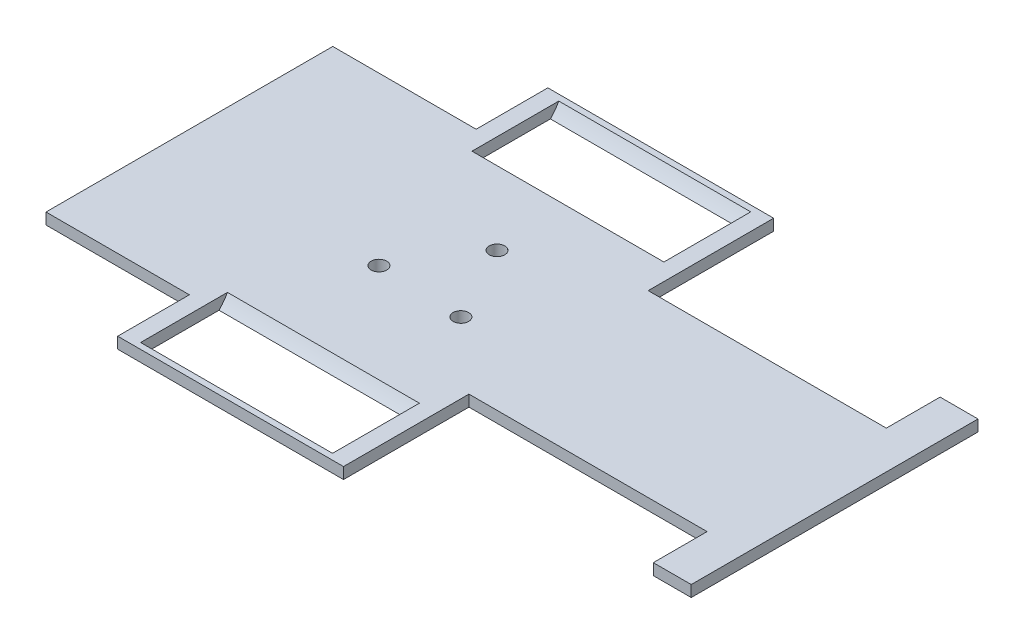
from build123d import *

# Parameters (mm, degrees)
BOSS_EXTRUDE1_DEPTH    = 4
SPLIT2_SURFACE_1_BACK  = 275.772
SPLIT2_SURFACE_1_DEPTH = 551.544
SPLIT2_SURFACE_2_BACK  = 275.772
SPLIT2_SURFACE_2_DEPTH = 551.544
BOSS_EXTRUDE4_START    = -76.2
BOSS_EXTRUDE4_DEPTH    = 152.4
SKETCH8_R              = 17.5
CUT_EXTRUDE4_DEPTH     = 68
SKETCH11_R             = 2.75
CUT_EXTRUDE6_DEPTH     = 138.734999183
SKETCH12_W             = 167.624585895
SKETCH12_H             = 26.062825832
CUT_EXTRUDE7_DEPTH     = 147.892749991


with BuildPart() as part:
    # Sketch1 → Boss-Extrude1 (new body)
    with BuildSketch(Plane(origin=(0, 0, 0), x_dir=(1, 0, 0), z_dir=(0, 1, 0))):
        Polygon((-114.3, 50.8), (-114.3, -50.8), (-63.5, -50.8), (-63.5, -76.2), (16.5, -76.2), (16.5, -31.75), (100.867964722, -31.75), (100.867964722, -50.8), (114.3, -50.8), (114.3, 50.8), (100.867964722, 50.8), (100.867964722, 31.75), (16.5, 31.75), (16.5, 76.2), (-63.5, 76.2), (-63.5, 50.8), align=None)
    extrude(amount=BOSS_EXTRUDE1_DEPTH)


with BuildPart() as body_2:
    # Split2: the piece behind the surface
    add(part.part)
    # Split2 surface: a surface, the sketch's curves swept straight by 551.544 mm
    with BuildLine(Plane.XY.offset(76.2).offset(-SPLIT2_SURFACE_1_BACK), mode=Mode.PRIVATE) as split2_surface_1_path:
        Line((16.5, 0), (-23.5, 0))
        Line((-23.5, 0), (-23.5, 2))
        Line((-23.5, 2), (-63.5, 2))
        Line((-63.5, 2), (-63.5, 4))
    split2_surface_1 = Shell.extrude(split2_surface_1_path.wire(), (0 * SPLIT2_SURFACE_1_DEPTH, 0 * SPLIT2_SURFACE_1_DEPTH, 1 * SPLIT2_SURFACE_1_DEPTH))
    split(bisect_by=split2_surface_1, keep=Keep.BOTTOM)


with BuildPart() as part_1:
    add(part.part)

    # Split2: split by a surface, the side it looks to stays
    # Split2 surface: a surface, the sketch's curves swept straight by 551.544 mm
    with BuildLine(Plane.XY.offset(76.2).offset(-SPLIT2_SURFACE_2_BACK), mode=Mode.PRIVATE) as split2_surface_2_path:
        Line((16.5, 0), (-23.5, 0))
        Line((-23.5, 0), (-23.5, 2))
        Line((-23.5, 2), (-63.5, 2))
        Line((-63.5, 2), (-63.5, 4))
    split2_surface_2 = Shell.extrude(split2_surface_2_path.wire(), (0 * SPLIT2_SURFACE_2_DEPTH, 0 * SPLIT2_SURFACE_2_DEPTH, 1 * SPLIT2_SURFACE_2_DEPTH))
    split(bisect_by=split2_surface_2, keep=Keep.TOP)

    add(body_2.part)  # Boss-Extrude4 merges body 2
    # Boss-Extrude4: read off the stored shape, not the designer's step
    # Boss-Extrude4 outline → Boss-Extrude4 (add)
    with BuildSketch(Plane.XY.offset(BOSS_EXTRUDE4_START)):
        Polygon((-57.5, 4), (-63.5, 4), (-63.5, 0), (16.5, 0), (16.5, 4), (10.5, 4), (10.5, 14), (-57.5, 14), align=None)
    extrude(amount=BOSS_EXTRUDE4_DEPTH)

    # Sketch8 → Cut-Extrude4 (cut)
    with BuildSketch(Plane(origin=(10.5, 0, 0), x_dir=(0, 0, -1), z_dir=(1, 0, 0))):
        with Locations((-58.7, 12.344512168)):
            Circle(SKETCH8_R)
        with Locations((58.7, 12.344512168)):
            Circle(SKETCH8_R)
    extrude(amount=-CUT_EXTRUDE4_DEPTH, mode=Mode.SUBTRACT)


with BuildPart() as cut_extrude4_piece_1:
    # of the separate pieces the step leaves, piece 1, a body of its own (cut_extrude4_pieces)
    add(part_1.part.solids().sort_by_distance((16.5, 0, -31.75))[0])

    # Sketch11 → Cut-Extrude6 (cut, through all)
    with BuildSketch(Plane(origin=(0, 4, 0), x_dir=(1, 0, 0), z_dir=(0, 1, 0))):
        with Locations(Location((-22.643612575, 17.341502836, 0), (0, 0, 270))):
            Circle(SKETCH11_R)
        with Locations(Location((-38.877222753, -8.255760701, 0), (0, 0, 270))):
            Circle(SKETCH11_R)
        with Locations(Location((-8.592537174, -9.515847743, 0), (0, 0, 270))):
            Circle(SKETCH11_R)
    extrude(amount=-CUT_EXTRUDE6_DEPTH, mode=Mode.SUBTRACT)


with BuildPart() as cut_extrude4_piece_2:
    # of the separate pieces the step leaves, piece 2, a body of its own (cut_extrude4_pieces)
    add(part_1.part.solids().sort_by_distance((10.5, 14, 76.2))[0])


with BuildPart() as cut_extrude4_piece_3:
    # of the separate pieces the step leaves, piece 3, a body of its own (cut_extrude4_pieces)
    add(part_1.part.solids().sort_by_distance((-57.5, 14, -76.2))[0])


with BuildPart() as cut_extrude7_tool:
    # Sketch12 → Cut-Extrude7 (new, through all)
    with BuildSketch(Plane(origin=(10.5, 0, 0), x_dir=(0, 0, -1), z_dir=(1, 0, 0))):
        with Locations((1.392837232, 17.031412916)):
            Rectangle(SKETCH12_W, SKETCH12_H)
    extrude(amount=-CUT_EXTRUDE7_DEPTH)


with BuildPart() as cut_extrude4_piece_1_1:
    add(cut_extrude4_piece_1.part)

    # Cut-Extrude7: cut by cut_extrude7_tool
    add(cut_extrude7_tool.part, mode=Mode.SUBTRACT)


with BuildPart() as cut_extrude4_piece_2_1:
    add(cut_extrude4_piece_2.part)

    # Cut-Extrude7: cut by cut_extrude7_tool
    add(cut_extrude7_tool.part, mode=Mode.SUBTRACT)


with BuildPart() as cut_extrude4_piece_3_1:
    add(cut_extrude4_piece_3.part)

    # Cut-Extrude7: cut by cut_extrude7_tool
    add(cut_extrude7_tool.part, mode=Mode.SUBTRACT)


solid = cut_extrude4_piece_1_1.part
